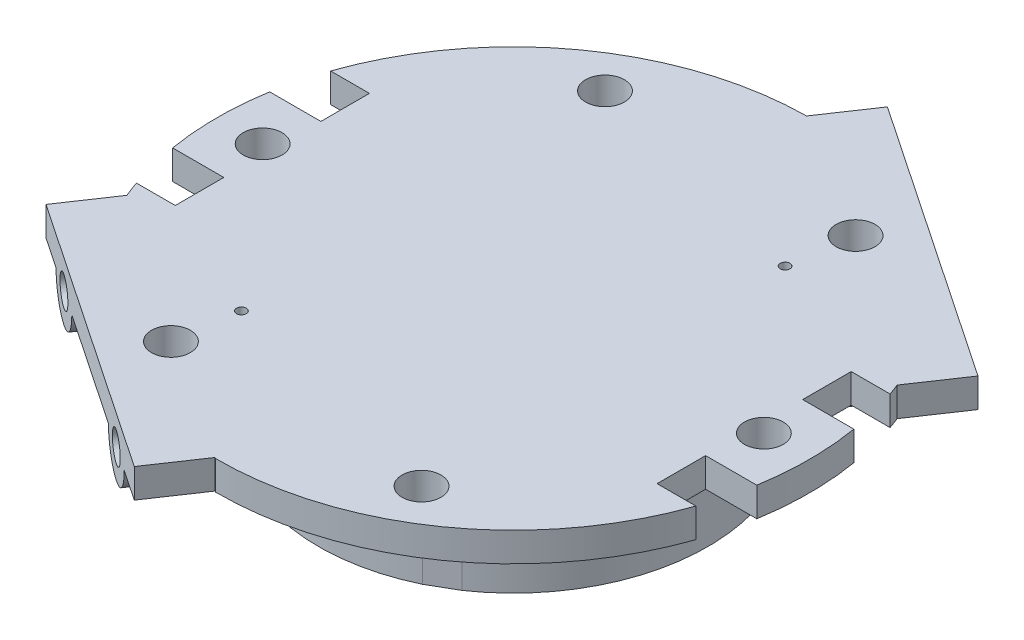
from build123d import *

# Parameters (mm, degrees)
CROQUIS1_R              = 30.5
SALIENTE_EXTRUIR1_DEPTH = 3
CORTAR_EXTRUIR3_START   = -4
CORTAR_EXTRUIR3_DEPTH   = 4
CROQUIS7_R              = 2
CORTAR_EXTRUIR4_DEPTH   = 10
CROQUIS8_R              = 0.5
CORTAR_EXTRUIR5_DEPTH   = 3
SALIENTE_EXTRUIR2_DEPTH = 13
CROQUIS11_W             = 34.583232932
CROQUIS11_H             = 3
SALIENTE_EXTRUIR3_DEPTH = 6
CROQUIS12_R             = 2
CORTAR_EXTRUIR7_DEPTH   = 3
CROQUIS13_R             = 3
SALIENTE_EXTRUIR4_DEPTH = 20
CROQUIS14_R             = 1.5
CORTAR_EXTRUIR8_DEPTH   = 6
CORTAR_EXTRUIR9_START   = -3
CORTAR_EXTRUIR9_DEPTH   = 3
CROQUIS16_W             = 33.68877148
CROQUIS16_H             = 3
SALIENTE_EXTRUIR5_DEPTH = 6
CROQUIS17_R             = 2
CORTAR_EXTRUIR10_DEPTH  = 3
CROQUIS18_R             = 3
SALIENTE_EXTRUIR6_DEPTH = 25
CROQUIS19_R             = 1.5
CORTAR_EXTRUIR11_DEPTH  = 5


with BuildPart() as part:
    # Croquis1 → Saliente-Extruir1 (new body)
    with BuildSketch(Plane(origin=(0, 0, 0), x_dir=(1, 0, 0), z_dir=(0, 1, 0))):
        Circle(CROQUIS1_R)
    extrude(amount=SALIENTE_EXTRUIR1_DEPTH)

    # Croquis5 → Cortar-Extruir3 (cut)
    with BuildSketch(Plane(origin=(0, 3, 0), x_dir=(1, 0, 0), z_dir=(0, 1, 0)).offset(CORTAR_EXTRUIR3_START)):
        with BuildLine():
            Line((30.087372767, -5), (24.814059068, -5))
            Line((24.814059068, -5), (24.814059068, -10))
            Line((24.814059068, -10), (28.814059068, -10))
            ThreePointArc((28.814059068, -10), (29.556634924, -7.526973624), (30.087372767, -5))
        make_face()
        with BuildLine():
            ThreePointArc((-30.087372767, -5), (-29.556634924, -7.526973624), (-28.814059068, -10))
            Line((-28.814059068, -10), (-24.814059068, -10))
            Line((-24.814059068, -10), (-24.814059068, -5))
            Line((-24.814059068, -5), (-30.087372767, -5))
        make_face()
        with BuildLine():
            Line((24.814059068, 5), (30.087372767, 5))
            ThreePointArc((30.087372767, 5), (29.556634924, 7.526973624), (28.814059068, 10))
            Line((28.814059068, 10), (24.814059068, 10))
            Line((24.814059068, 10), (24.814059068, 5))
        make_face()
        with BuildLine():
            ThreePointArc((-28.814059068, 10), (-29.556634924, 7.526973624), (-30.087372767, 5))
            Line((-30.087372767, 5), (-24.814059068, 5))
            Line((-24.814059068, 5), (-24.814059068, 10))
            Line((-24.814059068, 10), (-28.814059068, 10))
        make_face()
    extrude(amount=CORTAR_EXTRUIR3_DEPTH, mode=Mode.SUBTRACT)

    # Croquis7 → Cortar-Extruir4 (cut)
    with BuildSketch(Plane(origin=(0, 3, 0), x_dir=(1, 0, 0), z_dir=(0, 1, 0))):
        with Locations((25.81405907, 0)):
            Circle(CROQUIS7_R)
        with Locations((12.907029535, 22.355630929)):
            Circle(CROQUIS7_R)
        with Locations((12.907029535, -22.355630929)):
            Circle(CROQUIS7_R)
        with Locations((-12.907029535, 22.355630929)):
            Circle(CROQUIS7_R)
        with Locations((-12.907029535, -22.355630929)):
            Circle(CROQUIS7_R)
        with Locations((-25.81405907, 0)):
            Circle(CROQUIS7_R)
    extrude(amount=-CORTAR_EXTRUIR4_DEPTH, mode=Mode.SUBTRACT)

    # Croquis8 → Cortar-Extruir5 (cut)
    with BuildSketch(Plane(origin=(0, 3, 0), x_dir=(1, 0, 0), z_dir=(0, 1, 0))):
        with Locations((12, 16)):
            Circle(CROQUIS8_R)
        with Locations((-12, -16)):
            Circle(CROQUIS8_R)
    extrude(amount=-CORTAR_EXTRUIR5_DEPTH, mode=Mode.SUBTRACT)

    # Croquis9 → Saliente-Extruir2 (add)
    with BuildSketch(Plane(origin=(0, 3, 0), x_dir=(1, 0, 0), z_dir=(0, 1, 0))):
        with BuildLine():
            Line((-8.700961894, 18.070508076), (-10, 17.320508076))
            Line((-10, 17.320508076), (-11.299038106, 16.570508076))
            ThreePointArc((-11.299038106, 16.570508076), (-19.960969499, 1.951844427), (-14.294950117, -14.067849912))
            ThreePointArc((-14.294950117, -14.067849912), (-10.97161543, -13.181769141), (-9, -16))
            ThreePointArc((-9, -16), (-9.12838457, -16.868230859), (-9.502549883, -17.662150088))
            ThreePointArc((-9.502549883, -17.662150088), (-0.449805389, -20.05112653), (8.700961894, -18.070508076))
            Line((8.700961894, -18.070508076), (10, -17.320508076))
            Line((10, -17.320508076), (11.299038106, -16.570508076))
            ThreePointArc((11.299038106, -16.570508076), (17.732250869, -9.371087404), (20.05617112, 0))
            ThreePointArc((20.05617112, 0), (18.560064193, 7.600922125), (14.294950117, 14.067849912))
            ThreePointArc((14.294950117, 14.067849912), (10.2, 13.6), (9.502549883, 17.662150088))
            ThreePointArc((9.502549883, 17.662150088), (0.449805389, 20.05112653), (-8.700961894, 18.070508076))
        make_face()
    extrude(amount=-SALIENTE_EXTRUIR2_DEPTH)

    # Croquis11 → Saliente-Extruir3 (add)
    with BuildSketch(Plane(origin=(14.04954782, 0, -20.829311224), x_dir=(-0.8290375725550414, 0, -0.5591929034707472), z_dir=(0.5591929034707472, 0, -0.8290375725550414))):
        with Locations((0, 1.5)):
            Rectangle(CROQUIS11_W, CROQUIS11_H)
    extrude(amount=SALIENTE_EXTRUIR3_DEPTH)

    # Croquis12 → Cortar-Extruir7 (cut)
    with BuildSketch(Plane(origin=(0, 3, 0), x_dir=(1, 0, 0), z_dir=(0, 1, 0))):
        with Locations((12.907029535, 22.355630929)):
            Circle(CROQUIS12_R)
    extrude(amount=-CORTAR_EXTRUIR7_DEPTH, mode=Mode.SUBTRACT)

    # Croquis13 → Saliente-Extruir4 (add)
    # profile 1 of 2: a face of its own
    with BuildSketch(Plane(origin=(17.404705241, 0, -25.803536659), x_dir=(-0.8290375725550414, 0, -0.5591929034707472), z_dir=(0.5591929034707472, 0, -0.8290375725550414))):
        with Locations((-10, 0)):
            Circle(CROQUIS13_R)
        with BuildLine():
            ThreePointArc((-11.5, 0), (-10, 1.5), (-8.5, 0))
            Line((-8.5, 0), (-11.5, 0))
        make_face(mode=Mode.SUBTRACT)
    # profile 2 of 2: a face of its own
    with BuildSketch(Plane(origin=(17.404705241, 0, -25.803536659), x_dir=(-0.8290375725550414, 0, -0.5591929034707472), z_dir=(0.5591929034707472, 0, -0.8290375725550414))):
        with Locations((10, 0)):
            Circle(CROQUIS13_R)
        with BuildLine():
            ThreePointArc((8.5, 0), (10, 1.5), (11.5, 0))
            Line((11.5, 0), (8.5, 0))
        make_face(mode=Mode.SUBTRACT)
    extrude(amount=-SALIENTE_EXTRUIR4_DEPTH)

    # Croquis14 → Cortar-Extruir8 (cut)
    with BuildSketch(Plane(origin=(17.404705241, 0, -25.803536659), x_dir=(-0.8290375725550414, 0, -0.5591929034707472), z_dir=(0.5591929034707472, 0, -0.8290375725550414))):
        with Locations((-10, 0)):
            Circle(CROQUIS14_R)
        with Locations((10, 0)):
            Circle(CROQUIS14_R)
    extrude(amount=-CORTAR_EXTRUIR8_DEPTH, mode=Mode.SUBTRACT)

    # Croquis15 → Cortar-Extruir9 (cut)
    with BuildSketch(Plane(origin=(0, 3, 0), x_dir=(1, 0, 0), z_dir=(0, 1, 0)).offset(CORTAR_EXTRUIR9_START)):
        with BuildLine():
            ThreePointArc((-28.212513648, -11.588963441), (-17.055383556, -25.285645963), (-0.176506165, -30.499489267))
            Line((-0.176506165, -30.499489267), (-11.071782568, -23.15053254))
            ThreePointArc((-11.071782568, -23.15053254), (-14.025415342, -24.013706075), (-14.331545089, -20.951794957))
            Line((-14.331545089, -20.951794957), (-28.212513648, -11.588963441))
        make_face()
    extrude(amount=CORTAR_EXTRUIR9_DEPTH, mode=Mode.SUBTRACT)

    # Croquis16 → Saliente-Extruir5 (add)
    with BuildSketch(Plane(origin=(-14.194509906, 0, 21.044226354), x_dir=(0.8290375725550415, 0, 0.5591929034707472), z_dir=(-0.5591929034707471, 0, 0.8290375725550414))):
        with Locations((-0.064381976, 1.5)):
            Rectangle(CROQUIS16_W, CROQUIS16_H)
    extrude(amount=SALIENTE_EXTRUIR5_DEPTH)

    # Croquis17 → Cortar-Extruir10 (cut)
    with BuildSketch(Plane(origin=(0, 3, 0), x_dir=(1, 0, 0), z_dir=(0, 1, 0))):
        with Locations((-12.907029535, -22.355630929)):
            Circle(CROQUIS17_R)
    extrude(amount=-CORTAR_EXTRUIR10_DEPTH, mode=Mode.SUBTRACT)

    # Croquis18 → Saliente-Extruir6 (add)
    with BuildSketch(Plane(origin=(-17.549667327, 0, 26.01845179), x_dir=(0.8290375725550416, 0, 0.5591929034707471), z_dir=(-0.5591929034707471, 0, 0.8290375725550416))):
        with Locations((9.935618024, 0)):
            Circle(CROQUIS18_R)
        with Locations((-10.064381976, 0)):
            Circle(CROQUIS18_R)
    extrude(amount=-SALIENTE_EXTRUIR6_DEPTH)

    # Croquis19 → Cortar-Extruir11 (cut)
    with BuildSketch(Plane(origin=(-17.549667327, 0, 26.01845179), x_dir=(0.8290375725550416, 0, 0.5591929034707471), z_dir=(-0.5591929034707471, 0, 0.8290375725550416))):
        with Locations((-10.064381976, 0)):
            Circle(CROQUIS19_R)
        with Locations((9.935618024, 0)):
            Circle(CROQUIS19_R)
    extrude(amount=-CORTAR_EXTRUIR11_DEPTH, mode=Mode.SUBTRACT)


solid = part.part
